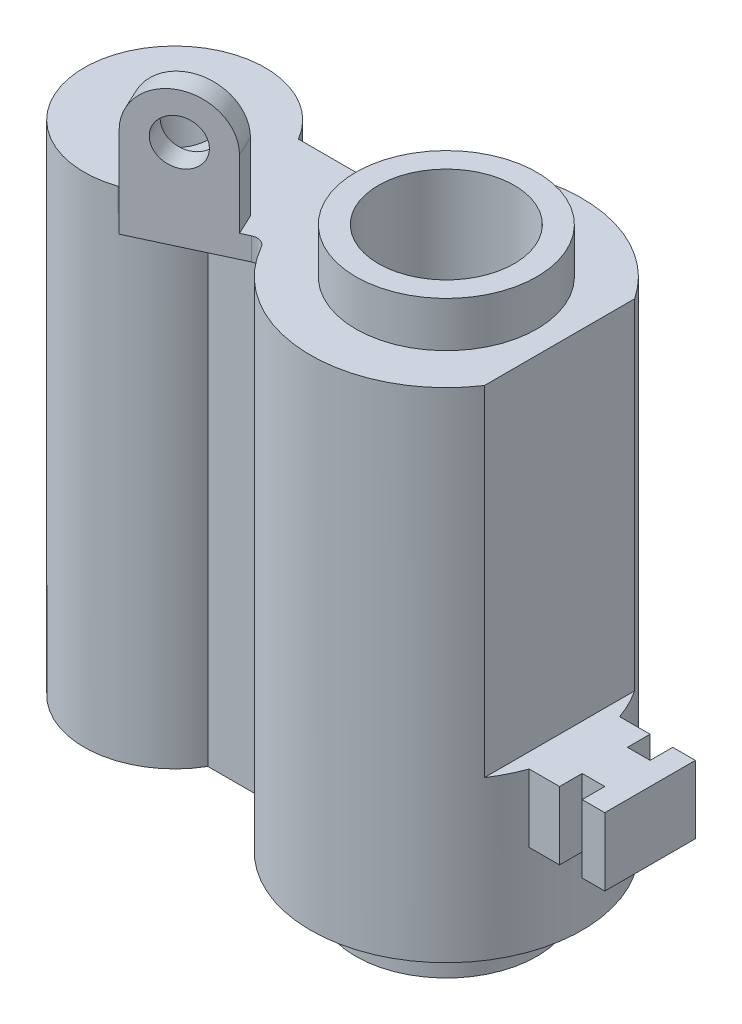
from build123d import *

# Parameters (mm, degrees)
SKETCH1_R                 = 4
BOSS_EXTRUDE1_DEPTH       = 22
BOSS_EXTRUDE2_DEPTH       = 24
BOSS_EXTRUDE2_DEPTH_BACK  = 2
SKETCH1_3_R               = 4
SKETCH1_3_R_2             = 3
CUT_EXTRUDE1_DEPTH        = 18
BOSS_EXTRUDE3_DEPTH       = 3
SKETCH3_W                 = 1
SKETCH3_H                 = 1
CUT_EXTRUDE2_DEPTH        = 2
BOSS_EXTRUDE7_START       = -1
BOSS_EXTRUDE7_DEPTH       = 1
BOSS_EXTRUDE8_DEPTH       = 5
CUT_EXTRUDE8_REACH        = 33.953
SKETCH8_R                 = 1
FILLET1_R                 = 0.5
F_4_0MM_DOWEL_HOLE1_D     = 4
F_4_0MM_DOWEL_HOLE1_DEPTH = 5.798278762
F_4_0MM_DOWEL_HOLE1_TIP   = 1.201721238
F_3_0MM_DOWEL_HOLE1_D     = 3
F_3_0MM_DOWEL_HOLE1_DEPTH = 6.098709071
F_3_0MM_DOWEL_HOLE1_TIP   = 0.901290929


with BuildPart() as part:
    # Sketch1 → Boss-Extrude1 (new body)
    with BuildSketch(Plane(origin=(0, 0, 0), x_dir=(1, 0, 0), z_dir=(0, 1, 0))):
        with BuildLine():
            Line((-5.656854249, 2), (-8.535898385, 2))
            ThreePointArc((-8.535898385, 2), (-16, 0), (-8.535898385, -2))
            Line((-8.535898385, -2), (-5.656854249, -2))
            ThreePointArc((-5.656854249, -2), (6, 0), (-5.656854249, 2))
        make_face()
        with Locations(Location((0, 0, 0), (0, 0, 270))):
            Circle(SKETCH1_R, mode=Mode.SUBTRACT)
    extrude(amount=BOSS_EXTRUDE1_DEPTH)

    # Sketch1<3> → Boss-Extrude2 (add, two sides: drawn at the far end of the back side and taken through both)
    with BuildSketch(Plane(origin=(0, 0, 0), x_dir=(1, 0, 0), z_dir=(0, 1, 0)).offset(-BOSS_EXTRUDE2_DEPTH_BACK)):
        with Locations(Location((0, 0, 0), (0, 0, 270))):
            Circle(SKETCH1_3_R)
        with Locations(Location((0, 0, 0), (0, 0, 270))):
            Circle(SKETCH1_3_R_2, mode=Mode.SUBTRACT)
    extrude(amount=BOSS_EXTRUDE2_DEPTH + BOSS_EXTRUDE2_DEPTH_BACK)

    # Sketch2 → Cut-Extrude1 (cut)
    with BuildSketch(Plane(origin=(0, 4, 0), x_dir=(1, 0, 0), z_dir=(0, 1, 0))):
        with BuildLine():
            ThreePointArc((5.656854249, 2), (5.368939451, 2.678523692), (5, 3.31662479))
            Line((5, 3.31662479), (5, 0))
            Line((5, 0), (6, 0))
            ThreePointArc((6, 0), (5.913591358, 1.014611872), (5.656854249, 2))
        make_face()
        with BuildLine():
            Line((6, 0), (5, 0))
            Line((5, 0), (5, -3.31662479))
            ThreePointArc((5, -3.31662479), (5.368939451, -2.678523692), (5.656854249, -2))
            ThreePointArc((5.656854249, -2), (5.913591358, -1.014611872), (6, 0))
        make_face()
    extrude(amount=CUT_EXTRUDE1_DEPTH, mode=Mode.SUBTRACT)

    # Sketch2<3> → Boss-Extrude3 (add)
    with BuildSketch(Plane(origin=(0, 4, 0), x_dir=(1, 0, 0), z_dir=(0, 1, 0))):
        with BuildLine():
            Line((5, 3.31662479), (5, -3.31662479))
            ThreePointArc((5, -3.31662479), (5.368939451, -2.678523692), (5.656854249, -2))
            Line((5.656854249, -2), (7, -2))
            Line((7, -2), (7, -1))
            Line((7, -1), (8, -1))
            Line((8, -1), (8, -2))
            Line((8, -2), (9, -2))
            Line((9, -2), (9, 2))
            Line((9, 2), (8, 2))
            Line((8, 2), (8, 1))
            Line((8, 1), (7, 1))
            Line((7, 1), (7, 2))
            Line((7, 2), (5.656854249, 2))
            ThreePointArc((5.656854249, 2), (5.368939451, 2.678523692), (5, 3.31662479))
        make_face()
    extrude(amount=BOSS_EXTRUDE3_DEPTH)

    # Sketch3 → Cut-Extrude2 (cut)
    with BuildSketch(Plane.XY.offset(1)):
        with Locations((7.5, 4.5)):
            Rectangle(SKETCH3_W, SKETCH3_H)
    extrude(amount=-CUT_EXTRUDE2_DEPTH, mode=Mode.SUBTRACT)

    # Sketch6 → Boss-Extrude7 (add)
    with BuildSketch(Plane(origin=(0, 22, 0), x_dir=(1, 0, 0), z_dir=(0, 1, 0)).offset(BOSS_EXTRUDE7_START)):
        Polygon((-9.856725658, -4.596266659), (-6.232597162, -2.906307787), (-6.655215424, -2), (-10.27934392, -3.689958872), align=None)
        Polygon((-6.232597162, -2.906307787), (-5.412549479, -2.523913272), (-5.83516774, -1.617605485), (-6.655215424, -2), align=None)
        with BuildLine():
            Line((-10.27934392, -3.689958872), (-6.655215424, -2))
            Line((-6.655215424, -2), (-8.535898385, -2))
            ThreePointArc((-8.535898385, -2), (-9.29763917, -2.949109347), (-10.309526953, -3.625231148))
            Line((-10.309526953, -3.625231148), (-10.27934392, -3.689958872))
        make_face()
    extrude(amount=BOSS_EXTRUDE7_DEPTH)

    # Sketch7 → Boss-Extrude8 (add)
    with BuildSketch(Plane(origin=(0, 22, 0), x_dir=(1, 0, 0), z_dir=(0, 1, 0))):
        Polygon((-10.27934392, -3.689958872), (-6.654112772, -1.999485825), (-6.23149451, -2.905793612), (-9.856725658, -4.596266659), align=None)
    extrude(amount=BOSS_EXTRUDE8_DEPTH)

    # Sketch8 → Cut-Extrude8 (cut, up to next)
    with BuildSketch(Plane(origin=(0, 0, 0), x_dir=(0.9063077870366509, 0, -0.42261826174069733), z_dir=(0.42261826174069733, 0, 0.9063077870366509)), mode=Mode.PRIVATE) as cut_extrude8_sk1:
        with BuildLine():
            ThreePointArc((-10.875693444, 25), (-10.289907007, 26.414213562), (-8.875693444, 27))
            Line((-8.875693444, 27), (-10.875693444, 27))
            Line((-10.875693444, 27), (-10.875693444, 25))
        make_face()
    cut_extrude8_tool1 = extrude(cut_extrude8_sk1.sketch, amount=-CUT_EXTRUDE8_REACH, mode=Mode.PRIVATE) & part.part
    # Sketch8 → Cut-Extrude8 (cut, up to next)
    with BuildSketch(Plane(origin=(0, 0, 0), x_dir=(0.9063077870366509, 0, -0.42261826174069733), z_dir=(0.42261826174069733, 0, 0.9063077870366509)), mode=Mode.PRIVATE) as cut_extrude8_sk2:
        with BuildLine():
            ThreePointArc((-8.875693444, 27), (-7.461479882, 26.414213562), (-6.875693444, 25))
            Line((-6.875693444, 25), (-6.875693444, 27))
            Line((-6.875693444, 27), (-8.875693444, 27))
        make_face()
    cut_extrude8_tool2 = extrude(cut_extrude8_sk2.sketch, amount=-CUT_EXTRUDE8_REACH, mode=Mode.PRIVATE) & part.part
    # Sketch8 → Cut-Extrude8 (cut, up to next)
    with BuildSketch(Plane(origin=(0, 0, 0), x_dir=(0.9063077870366509, 0, -0.42261826174069733), z_dir=(0.42261826174069733, 0, 0.9063077870366509)), mode=Mode.PRIVATE) as cut_extrude8_sk3:
        with Locations((-8.875693444, 25)):
            Circle(SKETCH8_R)
    cut_extrude8_tool3 = extrude(cut_extrude8_sk3.sketch, amount=-CUT_EXTRUDE8_REACH, mode=Mode.PRIVATE) & part.part
    add(cut_extrude8_tool1.solids().sort_by_distance((-9.451845, 26.553264, 4.407468))[0], mode=Mode.SUBTRACT)
    add(cut_extrude8_tool2.solids().sort_by_distance((-6.636375, 26.553264, 3.094592))[0], mode=Mode.SUBTRACT)
    add(cut_extrude8_tool3.solids().sort_by_distance((-8.04411, 25, 3.75103))[0], mode=Mode.SUBTRACT)

    # Fillet1
    # the kernel refuses this fillet: 0.5 mm, written as the material it adds along each edge
    with BuildSketch(Plane(origin=(-5.437846722, 22, 2.53570957), x_dir=(0.4571889357830061, 0, 0.8893695952738672), z_dir=(0, -1, 0))) as fillet1_piece_1:
        with BuildLine():
            CenterArc((0.481125753, 0.499629492), FILLET1_R, 182.205862892, 85.588274215)
            Line((-0.018503738, 0.480384461), (0, 0))
            ThreePointArc((0, 0), (0.230940361, 0.004446102), (0.461880723, 0))
        make_face()
    extrude(amount=1)
    with BuildSketch(Plane(origin=(-10.309526953, 21, 3.625231148), x_dir=(-0.9284189548945215, 0, 0.3715349838071298), z_dir=(0, 1, 0))) as fillet1_piece_2:
        with BuildLine():
            CenterArc((0.472954925, 0.499225399), FILLET1_R, 183.189685104, 83.620629792)
            Line((-0.026270474, 0.471404521), (0, 0))
            ThreePointArc((0, 0), (0.222567024, 0.00619681), (0.445134047, 0))
        make_face()
    extrude(amount=1)

    # Ø4.0mm Dowel Hole1
    with Locations(Plane(origin=(0, 0, 0), x_dir=(-1, 0, 0), z_dir=(0, -1, 0))):
        with Locations((12, 0)):
            Hole(F_4_0MM_DOWEL_HOLE1_D / 2, depth=F_4_0MM_DOWEL_HOLE1_DEPTH)
            with Locations((0, 0, -(F_4_0MM_DOWEL_HOLE1_DEPTH + F_4_0MM_DOWEL_HOLE1_TIP / 2))):  # 118° drill point
                Cone(0, F_4_0MM_DOWEL_HOLE1_D / 2, F_4_0MM_DOWEL_HOLE1_TIP, mode=Mode.SUBTRACT)

    # Ø3.0mm Dowel Hole1
    with Locations(Plane(origin=(0, 22, 0), x_dir=(1, 0, 0), z_dir=(0, 1, 0))):
        with Locations((-12, 0)):
            Hole(F_3_0MM_DOWEL_HOLE1_D / 2, depth=F_3_0MM_DOWEL_HOLE1_DEPTH)
            with Locations((0, 0, -(F_3_0MM_DOWEL_HOLE1_DEPTH + F_3_0MM_DOWEL_HOLE1_TIP / 2))):  # 118° drill point
                Cone(0, F_3_0MM_DOWEL_HOLE1_D / 2, F_3_0MM_DOWEL_HOLE1_TIP, mode=Mode.SUBTRACT)


solid = part.part
